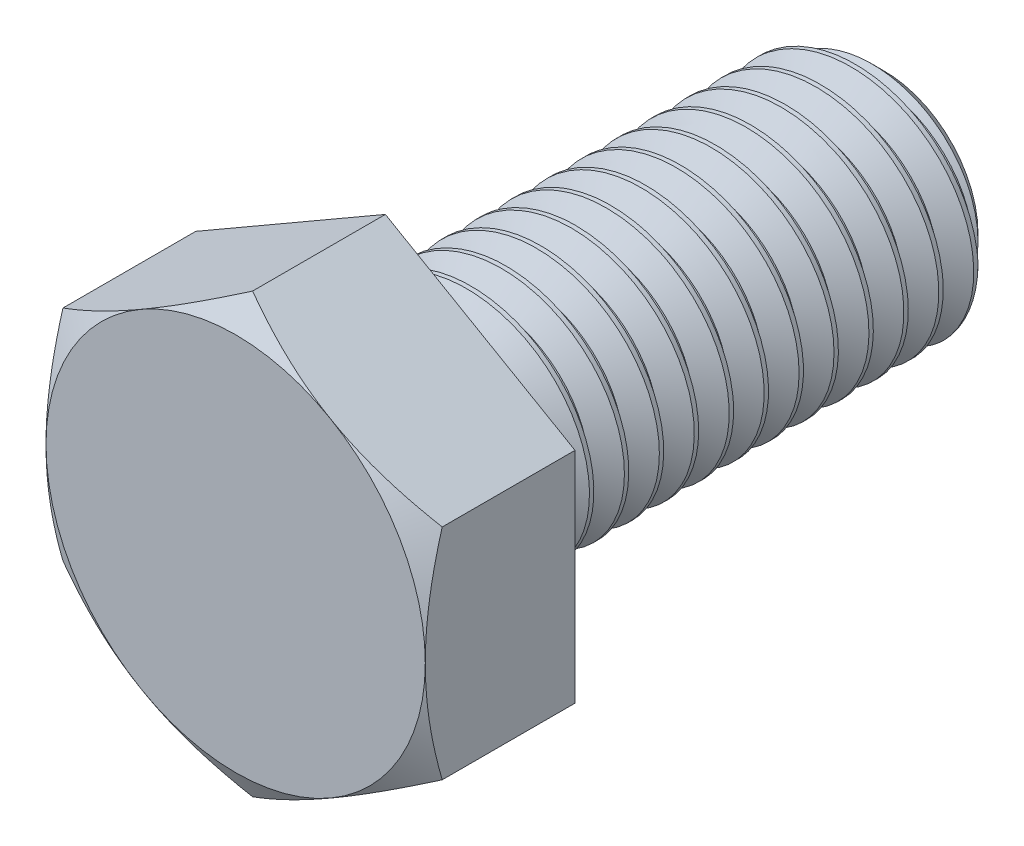
from build123d import *

# Parameters (mm, degrees)
BOSS_EXTRUDE1_DEPTH = 7.5
SKETCH4_OUTSIDE_W   = 156.476
SKETCH4_OUTSIDE_H   = 159.416
SKETCH4_OUTSIDE_R   = 9.5
CUT_EXTRUDE1_DEPTH  = 36.592602
CUT_EXTRUDE1_DRAFT  = -60
CUT_SWEEP1_PITCH    = 1.75
CUT_SWEEP1_TO       = 25


with BuildPart() as part:
    # Sketch2 → Revolve1 (revolve)
    with BuildSketch(Plane(origin=(0, 0, 0), x_dir=(0, 0, -1), z_dir=(1, 0, 0)), mode=Mode.PRIVATE) as revolve1_sk:
        Polygon((-16.25, 9.5), (-16.25, 0), (16.25, 0), (16.25, 4.6875), (14.9375, 6), (-8.75, 6), (-8.75, 9.5), align=None)
    revolve(revolve1_sk.sketch.rotate(Axis((0, 0, 16.25), (0, 0, -1)), 90), axis=Axis((0, 0, 16.25), (0, 0, -1)))

    # Sketch3 → Boss-Extrude1 (add)
    with BuildSketch(Plane.XY.offset(16.25)):
        Polygon((0, 10.969655), (-9.5, 5.484828), (-9.5, -5.484828), (0, -10.969655), (9.5, -5.484828), (9.5, 5.484828), align=None)
    extrude(amount=-BOSS_EXTRUDE1_DEPTH)


with BuildPart() as cut_extrude1_tool:
    # Sketch4 outside → Cut-Extrude1 (with draft: the straight prism first)
    with BuildSketch(Plane.XY.offset(16.25)):
        Rectangle(SKETCH4_OUTSIDE_W, SKETCH4_OUTSIDE_H)
        Circle(SKETCH4_OUTSIDE_R, mode=Mode.SUBTRACT)
    extrude(amount=-CUT_EXTRUDE1_DEPTH)
    # Cut-Extrude1: the draft: its side faces are tilted about the plane it starts from
    cut_extrude1_sides = [cut_extrude1_tool.faces().sort_by_distance(p)[0] for p in [
        (0, -79.708, -2.046301),
        (78.238, 0, -2.046301),
        (0, 79.708, -2.046301),
        (-78.238, 0, -2.046301),
        (-9.5, 0, -2.046301),
    ]]
    draft(cut_extrude1_sides, Plane.XY.offset(16.25), CUT_EXTRUDE1_DRAFT)


with BuildPart() as part_1:
    add(part.part)

    # Cut-Extrude1: cut by cut_extrude1_tool
    add(cut_extrude1_tool.part, mode=Mode.SUBTRACT)


with BuildPart() as body_2:
    # Split1: read off the stored shape, not the designer's step
    # Split1: the piece on the far side of the plane
    add(part_1.part)
    split(bisect_by=Plane.XY.offset(8.75), keep=Keep.BOTTOM)

    # Cut-Sweep1: arcs per turn and ends read off the stored shape
    # Cut-Sweep1: the profile of Sketch7 screwed along a right-hand helix through 15.285714 turns, 10 arcs to a turn; built about Z, then put on its axis
    cut_sweep1_z = Axis((0, 0, 0), (0, 0, 1))
    cut_sweep1_corners = [(6.094722, 0, 0.054688), (4.863342, 0, -0.65625), (4.863342, 0, -0.875), (6.094722, 0, -1.585938)]
    with BuildLine(mode=Mode.PRIVATE) as cut_sweep1_profile:
        Line(cut_sweep1_corners[0], cut_sweep1_corners[1])
        Line(cut_sweep1_corners[1], cut_sweep1_corners[2])
        Line(cut_sweep1_corners[2], cut_sweep1_corners[3])
        Line(cut_sweep1_corners[3], cut_sweep1_corners[0])
    cut_sweep1_cap = Face(cut_sweep1_profile.wire())
    cut_sweep1_turn_angles = [0, 18, 36, 54, 72, 90, 108, 126, 144, 162, 180, 198, 216, 234, 252, 270, 288, 306, 324, 342, 360]
    cut_sweep1_turn_weights = [1, 0.9510565162951535, 1, 0.9510565162951535, 1, 0.9510565162951535, 1, 0.9510565162951535, 1, 0.9510565162951535, 1, 0.9510565162951535, 1, 0.9510565162951535, 1, 0.9510565162951535, 1, 0.9510565162951535, 1, 0.9510565162951535, 1]
    cut_sweep1_turn_rails = [Edge.make_bspline([Vector(p[0], p[1], 0).rotate(cut_sweep1_z, cut_sweep1_turn_angles[k]) / cut_sweep1_turn_weights[k] + Vector(0, 0, p[2] + CUT_SWEEP1_PITCH * cut_sweep1_turn_angles[k] / 360) for k in range(21)], [0, 0, 0, 1, 1, 2, 2, 3, 3, 4, 4, 5, 5, 6, 6, 7, 7, 8, 8, 9, 9, 10, 10, 10], 2, cut_sweep1_turn_weights) for p in cut_sweep1_corners]
    cut_sweep1_turn_sides = [Face.make_surface_from_curves(cut_sweep1_turn_rails[p[0]], cut_sweep1_turn_rails[p[1]]) for p in [(0, 1), (1, 2), (2, 3), (3, 0)]]
    cut_sweep1_last_angles = [5400, 5418, 5436, 5454, 5472, 5487.428571, 5502.857143]
    cut_sweep1_last_weights = [1, 0.9510565162951535, 1, 0.9510565162951535, 1, 0.9639628606958759, 1]
    cut_sweep1_last_rails = [Edge.make_bspline([Vector(p[0], p[1], 0).rotate(cut_sweep1_z, cut_sweep1_last_angles[k]) / cut_sweep1_last_weights[k] + Vector(0, 0, p[2] + CUT_SWEEP1_PITCH * cut_sweep1_last_angles[k] / 360) for k in range(7)], [0, 0, 0, 1, 1, 2, 2, 3, 3, 3], 2, cut_sweep1_last_weights) for p in cut_sweep1_corners]
    cut_sweep1_last_sides = [Face.make_surface_from_curves(cut_sweep1_last_rails[p[0]], cut_sweep1_last_rails[p[1]]) for p in [(0, 1), (1, 2), (2, 3), (3, 0)]]
    cut_sweep1 = Plane(origin=(0, 0, -16.25), x_dir=(0, 1, 0), z_dir=(0, 0, 1)) * split(Solid(Shell([*[p.moved(Location((0, 0, CUT_SWEEP1_PITCH * i))) for i in range(15) for p in cut_sweep1_turn_sides], *cut_sweep1_last_sides, cut_sweep1_cap, cut_sweep1_cap.rotate(cut_sweep1_z, 5502.857143).moved(Location((0, 0, CUT_SWEEP1_PITCH * 5502.857143 / 360)))])), bisect_by=Plane.XY.offset(CUT_SWEEP1_TO), keep=Keep.BOTTOM, mode=Mode.PRIVATE)
    add(cut_sweep1, mode=Mode.SUBTRACT)


with BuildPart() as part_2:
    add(part_1.part)

    # Split1
    split(bisect_by=Plane.XY.offset(8.75), keep=Keep.TOP)

    add(body_2.part)  # Boss-Extrude2 merges body 2
    # Boss-Extrude2: read off the stored shape, not the designer's step
    # Boss-Extrude2 outline → Boss-Extrude2 (revolve)
    with BuildSketch(Plane.XZ):
        Polygon((4.863341, 8.75), (4.863341, 5.627056), (6, 8.75), align=None)
    revolve(axis=Axis((0, 0, 0), (0, 0, 1)))


solid = part_2.part
